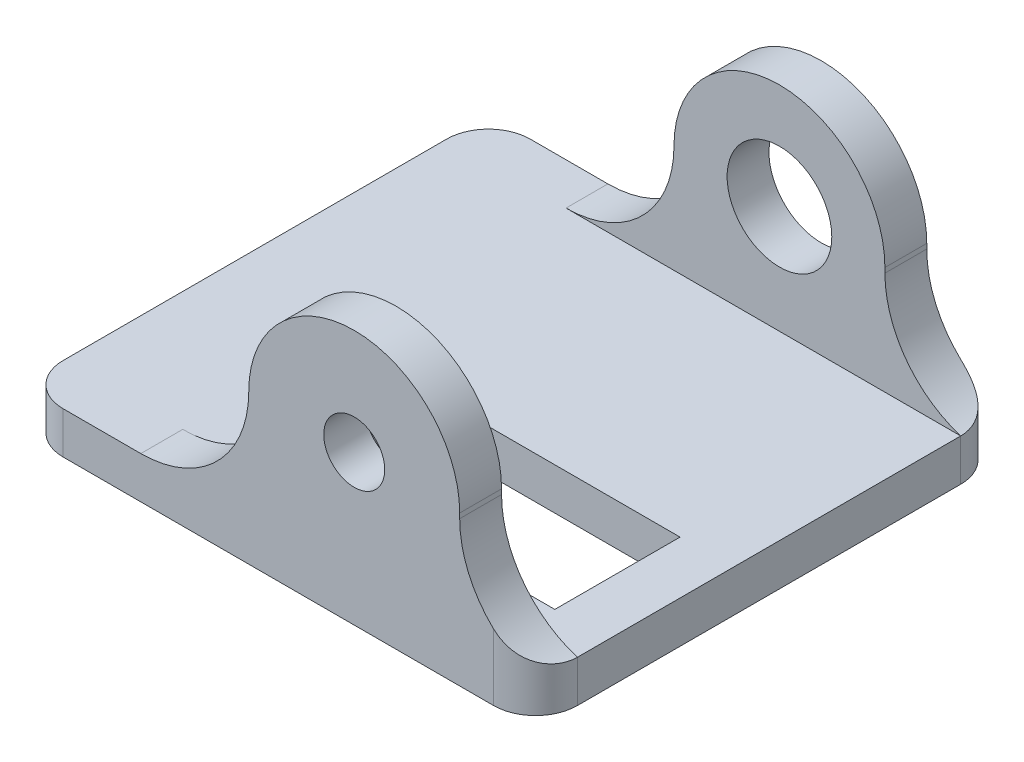
from build123d import *

# Parameters (mm, degrees)
SKETCH1_W            = 55
SKETCH1_H            = 70.86
SKETCH1_W_2          = 39
SKETCH1_H_2          = 19
BOSS_EXTRUDE1_DEPTH  = 6.35
SKETCH12_R           = 7.94
BOSS_EXTRUDE11_DEPTH = 6.35
BOSS_EXTRUDE14_START = -6.35
BOSS_EXTRUDE14_DEPTH = 6.35
SKETCH15_W           = 23
SKETCH15_H           = 70.86
BOSS_EXTRUDE13_DEPTH = 6.35
FILLET2_R            = 16.38
FILLET3_R            = 6.35
CUT_EXTRUDE1_REACH   = 92.618
SKETCH17_R           = 4.625


with BuildPart() as part:
    # Sketch1 → Boss-Extrude1 (new body)
    with BuildSketch(Plane(origin=(0, 0, 0), x_dir=(1, 0, 0), z_dir=(0, 1, 0))):
        with Locations((0, 15)):
            Rectangle(SKETCH1_W, SKETCH1_H)
        Rectangle(SKETCH1_W_2, SKETCH1_H_2, mode=Mode.SUBTRACT)
    extrude(amount=BOSS_EXTRUDE1_DEPTH)

    # Sketch12 → Boss-Extrude11 (add)
    with BuildSketch(Plane.XY.offset(-50.43)):
        with BuildLine():
            Line((16, 22.728660684), (16, 6.35))
            Line((16, 6.35), (-16, 6.35))
            Line((-16, 6.35), (-16, 22.728660684))
            ThreePointArc((-16, 22.728660684), (0, 38.728660684), (16, 22.728660684))
        make_face()
        with Locations((0, 22.728660684)):
            Circle(SKETCH12_R, mode=Mode.SUBTRACT)
    extrude(amount=BOSS_EXTRUDE11_DEPTH)

    # Sketch16 → Boss-Extrude14 (add)
    with BuildSketch(Plane.XY.offset(20.43).offset(BOSS_EXTRUDE14_START)):
        with BuildLine():
            Line((-16, 6.35), (-16, 22.728660684))
            ThreePointArc((-16, 22.728660684), (0, 38.728660684), (16, 22.728660684))
            Line((16, 22.728660684), (16, 6.35))
            Line((16, 6.35), (-16, 6.35))
        make_face()
    extrude(amount=BOSS_EXTRUDE14_DEPTH)

    # Sketch15 → Boss-Extrude13 (add)
    with BuildSketch(Plane(origin=(0, 6.35, 0), x_dir=(1, 0, 0), z_dir=(0, 1, 0))):
        with Locations((-39, 15)):
            Rectangle(SKETCH15_W, SKETCH15_H)
    extrude(amount=-BOSS_EXTRUDE13_DEPTH)

    # Fillet2
    # the kernel refuses this fillet: 16.38 mm, written as the material it adds along each edge
    with BuildSketch(Plane(origin=(16, 6.35, -50.43), x_dir=(0, 1, 0), z_dir=(0, 0, 1)), Plane(origin=(16, 6.35, 14.08), x_dir=(0, 1, 0), z_dir=(0, 0, 1))) as fillet2_piece_1:
        with BuildLine():
            CenterArc((15.636176003, -16.38), FILLET2_R, 90, 72.667025782)
            Line((0, -11.5), (0, 0))
            Line((0, 0), (15.636176003, 0))
        make_face()
    fillet2_piece_1_solid = extrude(amount=6.35, mode=Mode.PRIVATE)
    with BuildSketch(Plane(origin=(-16, 6.35, 14.08), x_dir=(8.356150350670102e-10, 1.0, 0), z_dir=(0, 0, 1)), Plane(origin=(-16, 6.35, -50.43), x_dir=(8.356150350670102e-10, 1.0, 0), z_dir=(0, 0, 1))) as fillet2_piece_2:
        with BuildLine():
            CenterArc((16.379999986, 16.379999986), FILLET2_R, 180.000000048, 89.997630107)
            Line((-1.4e-08, 16.379999972), (-1.638000014, 16.379999971))
            Line((-1.638000014, 16.379999971), (-1.637999999, -1.638000001))
            Line((-1.637999999, -1.638000001), (16.379254733, -1.637999999))
            Line((16.379254733, -1.637999999), (16.379322483, 0))
        make_face()
    fillet2_piece_2_solid = extrude(amount=6.35, mode=Mode.PRIVATE)
    add([fillet2_piece_1_solid, fillet2_piece_2_solid])

    # Fillet3
    fillet3_edges = [part.edges().sort_by_distance(p)[0] for p in [
        (27.5, 3.175, -50.43),
        (27.5, 3.175, 20.43),
        (-50.5, 3.175, 20.43),
        (-50.5, 3.175, -50.43),
    ]]
    fillet(fillet3_edges, radius=FILLET3_R)

    # Sketch17 → Cut-Extrude1 (cut, up to next)
    with BuildSketch(Plane(origin=(0, 0, 14.08), x_dir=(-1, 0, 0), z_dir=(0, 0, -1)), mode=Mode.PRIVATE) as cut_extrude1_sk1:
        with Locations((0, 22.728660684)):
            Circle(SKETCH17_R)
    cut_extrude1_tool1 = extrude(cut_extrude1_sk1.sketch, amount=-CUT_EXTRUDE1_REACH, mode=Mode.PRIVATE) & part.part
    add(cut_extrude1_tool1.solids().sort_by_distance((0, 22.728661, 14.08))[0], mode=Mode.SUBTRACT)


solid = part.part
